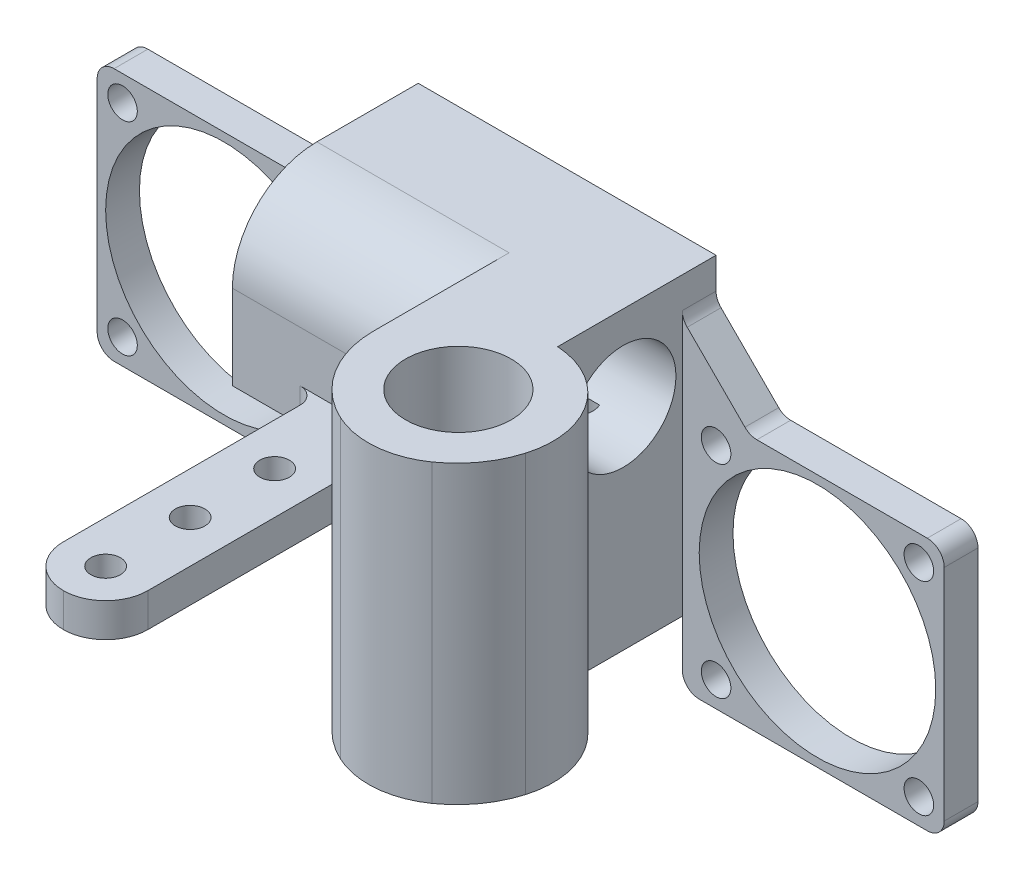
from build123d import *

# Parameters (mm, degrees)
EXTRUDE_1_DEPTH                  = 35
SKETCH_2_W                       = 22
SKETCH_2_H                       = 35
EXTRUDE_2_DEPTH                  = 22.75
SKETCH_3_W                       = 11
SKETCH_3_H                       = 15
CUT_EXTRUDE_1_DEPTH              = 32
HOLE_WIZARD_12_5_12_5_1_D        = 12.5
HOLE_WIZARD_12_5_12_5_2_D        = 12.5
HOLE_WIZARD_3_5_3_5_1_D          = 3.5
HOLE_WIZARD_3_5_3_5_1_DEPTH      = 5
SKETCH_10_W                      = 9.5
SKETCH_10_H                      = 18.75
CUT_EXTRUDE_2_DEPTH              = 64.639610362
SKETCH_11_W                      = 22.75
SKETCH_11_H                      = 11
CUT_EXTRUDE_3_DEPTH              = 15
FILLET_2_R                       = 10
SKETCH_13_W                      = 4
SKETCH_13_H                      = 30
EXTRUDE_3_DEPTH                  = 31
SKETCH_16_W                      = 1.75
SKETCH_16_H                      = 4
HOLE_WIZARD_3_5_3_5_2_AT_2_COUNT = 2
HOLE_WIZARD_3_5_3_5_2_AT_2_PITCH = 24
HOLE_WIZARD_3_5_3_5_2_AT_3_COUNT = 2
HOLE_WIZARD_3_5_3_5_2_AT_3_PITCH = 33.941125497
HOLE_WIZARD_3_5_3_5_2_AT_4_COUNT = 2
HOLE_WIZARD_3_5_3_5_2_AT_4_PITCH = 24
SKETCH_17_R                      = 14
CUT_EXTRUDE_4_DEPTH              = 76.494728698
SKETCH_19_W                      = 4
SKETCH_19_H                      = 30
EXTRUDE_5_DEPTH                  = 34
SKETCH_20_R                      = 14
CUT_EXTRUDE_5_DEPTH              = 76.494728698
SKETCH_22_W                      = 1.75
SKETCH_22_H                      = 4
HOLE_WIZARD_3_5_3_5_3_AT_2_COUNT = 2
HOLE_WIZARD_3_5_3_5_3_AT_2_PITCH = 24
HOLE_WIZARD_3_5_3_5_3_AT_3_COUNT = 2
HOLE_WIZARD_3_5_3_5_3_AT_3_PITCH = 33.941125497
HOLE_WIZARD_3_5_3_5_3_AT_4_COUNT = 2
HOLE_WIZARD_3_5_3_5_3_AT_4_PITCH = 24
EXTRUDE_6_DEPTH                  = 4
EXTRUDE_7_DEPTH                  = 4
SKETCH_26_W                      = 10
SKETCH_26_H                      = 4
EXTRUDE_8_DEPTH                  = 35
HOLE_WIZARD_3_5_3_5_4_D          = 3.5
FILLET_7_R                       = 2
FILLET_9_R                       = 5
FILLET_10_R                      = 10
FILLET_12_R                      = 10
FILLET_13_R                      = 2
FILLET_14_R                      = 2
CUT_EXTRUDE_6_DEPTH              = 86.007352664


# Some blends are built 0.0001 mm under size
with BuildPart() as part:
    # Эскиз1 → Бобышка-Вытянуть1 (new body)
    with BuildSketch(Plane(origin=(0, 35, 0), x_dir=(1, 0, 0), z_dir=(0, 1, 0))):
        with BuildLine():
            Line((35, 0), (13, 0))
            Line((13, 0), (13, -28))
            ThreePointArc((13, -28), (16.514718626, -36.485281374), (25, -40))
            ThreePointArc((25, -40), (32.16515139, -35.913807126), (35, -28.167840434))
            Line((35, -28.167840434), (35, 0))
        make_face()
    extrude(amount=-EXTRUDE_1_DEPTH)

    # Эскиз2 → Бобышка-Вытянуть2 (add)
    with BuildSketch(Plane.ZY.offset(-13)):
        with Locations((11, 17.5)):
            Rectangle(SKETCH_2_W, SKETCH_2_H)
    extrude(amount=EXTRUDE_2_DEPTH)

    # Эскиз3 → Вырез-Вытянуть1 (cut)
    with BuildSketch(Plane.ZY.offset(9.75)):
        with Locations((5.5, 7.5)):
            Rectangle(SKETCH_3_W, SKETCH_3_H)
    extrude(amount=-CUT_EXTRUDE_1_DEPTH, mode=Mode.SUBTRACT)

    # Диаметр отверстия Ø12.5 (12.5)1 (through all)
    with Locations(Plane(origin=(0, 35, 0), x_dir=(1, 0, 0), z_dir=(0, 1, 0))):
        with Locations((24, -29)):
            Hole(HOLE_WIZARD_12_5_12_5_1_D / 2)

    # Диаметр отверстия Ø12.5 (12.5)2 (through all)
    with Locations(Plane(origin=(35, 0, 0), x_dir=(0, 0, -1), z_dir=(1, 0, 0))):
        with Locations((-11, 25)):
            Hole(HOLE_WIZARD_12_5_12_5_2_D / 2)

    # Диаметр отверстия Ø3.5 (3.5)1
    with Locations(Plane(origin=(0, 15, 0), x_dir=(-1, 0, 0), z_dir=(0, -1, 0))):
        with Locations((-17.25, -7), (6.75, -7), (-12.25, -7), (1.75, -7)):
            Hole(HOLE_WIZARD_3_5_3_5_1_D / 2, depth=HOLE_WIZARD_3_5_3_5_1_DEPTH)

    # Эскиз10 → Вырез-Вытянуть2 (cut, through all)
    with BuildSketch(Plane.XZ):
        with Locations((30.25, 9.375)):
            Rectangle(SKETCH_10_W, SKETCH_10_H)
    extrude(amount=-CUT_EXTRUDE_2_DEPTH, mode=Mode.SUBTRACT)

    # Эскиз11 → Вырез-Вытянуть3 (cut)
    with BuildSketch(Plane.XZ):
        with Locations((1.625, 16.5)):
            Rectangle(SKETCH_11_W, SKETCH_11_H)
    extrude(amount=-CUT_EXTRUDE_3_DEPTH, mode=Mode.SUBTRACT)

    # Скругление2
    fillet_2_edges = [part.edges().sort_by_distance(p)[0] for p in [
        (25, 17.5, 40),
    ]]
    fillet(fillet_2_edges, radius=FILLET_2_R)

    # Эскиз19 → Бобышка-Вытянуть5 (add)
    with BuildSketch(Plane.ZY.offset(9.75)):
        with Locations((2, 7.5)):
            Rectangle(SKETCH_19_W, SKETCH_19_H)
    extrude(amount=EXTRUDE_5_DEPTH)

    # Эскиз20 → Вырез-Вытянуть5 (cut, through all)
    with BuildSketch(Plane.XY.offset(4)):
        with Locations((-28.75, 7.5)):
            Circle(SKETCH_20_R)
    extrude(amount=-CUT_EXTRUDE_5_DEPTH, mode=Mode.SUBTRACT)

    # Эскиз22 → Диаметр отверстия Ø3.5 (3.5)3 (revolve, cut)
    with BuildSketch(Plane(origin=(-16.75, 19.5, 4), x_dir=(0, -1, 0), z_dir=(1, 0, 0))):
        with Locations((0.875, 2)):
            Rectangle(SKETCH_22_W, SKETCH_22_H)
    hole_wizard_3_5_3_5_3 = revolve(axis=Axis((-16.75, 19.5, 10.35), (0, 0, -1)), mode=Mode.SUBTRACT)

    # Диаметр отверстия Ø3.5 (3.5)3 at 2: Диаметр отверстия Ø3.5 (3.5)3 ×2
    with Locations(*[(0, -i * HOLE_WIZARD_3_5_3_5_3_AT_2_PITCH, 0) for i in range(1, HOLE_WIZARD_3_5_3_5_3_AT_2_COUNT)]):
        add(hole_wizard_3_5_3_5_3, mode=Mode.SUBTRACT)

    # Диаметр отверстия Ø3.5 (3.5)3 at 3: Диаметр отверстия Ø3.5 (3.5)3 ×2
    with Locations(*[Vector(-0.7071067811865475, -0.7071067811865476, 0) * (i * HOLE_WIZARD_3_5_3_5_3_AT_3_PITCH) for i in range(1, HOLE_WIZARD_3_5_3_5_3_AT_3_COUNT)]):
        add(hole_wizard_3_5_3_5_3, mode=Mode.SUBTRACT)

    # Диаметр отверстия Ø3.5 (3.5)3 at 4: Диаметр отверстия Ø3.5 (3.5)3 ×2
    with Locations(*[(-i * HOLE_WIZARD_3_5_3_5_3_AT_4_PITCH, 0, 0) for i in range(1, HOLE_WIZARD_3_5_3_5_3_AT_4_COUNT)]):
        add(hole_wizard_3_5_3_5_3, mode=Mode.SUBTRACT)

    # Эскиз24 → Бобышка-Вытянуть6 (add)
    with BuildSketch(Plane.XY.offset(4)):
        Polygon((-9.75, 30.5), (-17.75, 22.5), (-9.75, 22.5), align=None)
    extrude(amount=-EXTRUDE_6_DEPTH)



with BuildPart() as body_2:
    # Эскиз13 → Бобышка-Вытянуть3 (new body)
    with BuildSketch(Plane(origin=(25.5, 0, 0), x_dir=(0, 0, -1), z_dir=(1, 0, 0))):
        with Locations((-2, 7.5)):
            Rectangle(SKETCH_13_W, SKETCH_13_H)
    extrude(amount=EXTRUDE_3_DEPTH)

    # Эскиз16 → Диаметр отверстия Ø3.5 (3.5)2 (revolve, cut)
    with BuildSketch(Plane(origin=(29.5, -4.5, 4), x_dir=(0, -1, 0), z_dir=(1, 0, 0))):
        with Locations((0.875, 2)):
            Rectangle(SKETCH_16_W, SKETCH_16_H)
    hole_wizard_3_5_3_5_2 = revolve(axis=Axis((29.5, -4.5, 10.35), (0, 0, -1)), mode=Mode.SUBTRACT)

    # Диаметр отверстия Ø3.5 (3.5)2 at 2: Диаметр отверстия Ø3.5 (3.5)2 ×2
    with Locations(*[(0, i * HOLE_WIZARD_3_5_3_5_2_AT_2_PITCH, 0) for i in range(1, HOLE_WIZARD_3_5_3_5_2_AT_2_COUNT)]):
        add(hole_wizard_3_5_3_5_2, mode=Mode.SUBTRACT)

    # Диаметр отверстия Ø3.5 (3.5)2 at 3: Диаметр отверстия Ø3.5 (3.5)2 ×2
    with Locations(*[Vector(0.7071067811865475, 0.7071067811865476, 0) * (i * HOLE_WIZARD_3_5_3_5_2_AT_3_PITCH) for i in range(1, HOLE_WIZARD_3_5_3_5_2_AT_3_COUNT)]):
        add(hole_wizard_3_5_3_5_2, mode=Mode.SUBTRACT)

    # Диаметр отверстия Ø3.5 (3.5)2 at 4: Диаметр отверстия Ø3.5 (3.5)2 ×2
    with Locations(*[(i * HOLE_WIZARD_3_5_3_5_2_AT_4_PITCH, 0, 0) for i in range(1, HOLE_WIZARD_3_5_3_5_2_AT_4_COUNT)]):
        add(hole_wizard_3_5_3_5_2, mode=Mode.SUBTRACT)

    # Эскиз17 → Вырез-Вытянуть4 (cut, through all)
    with BuildSketch(Plane.XY.offset(4)):
        with Locations((41.5, 7.5)):
            Circle(SKETCH_17_R)
    extrude(amount=-CUT_EXTRUDE_4_DEPTH, mode=Mode.SUBTRACT)


with BuildPart() as part_1:
    add(part.part)

    add(body_2.part)  # Бобышка-Вытянуть7 merges body 2
    # Эскиз25 → Бобышка-Вытянуть7 (add)
    with BuildSketch(Plane.XY.offset(4)):
        Polygon((33.5, 22.5), (25.5, 30.5), (25.5, 22.5), align=None)
    extrude(amount=-EXTRUDE_7_DEPTH)

    # Эскиз26 → Бобышка-Вытянуть8 (add)
    with BuildSketch(Plane.XY.offset(22)):
        with Locations((5.25, 17)):
            Rectangle(SKETCH_26_W, SKETCH_26_H)
    extrude(amount=EXTRUDE_8_DEPTH)

    # Диаметр отверстия Ø3.5 (3.5)4 (through all)
    with Locations(Plane(origin=(0, 15, 0), x_dir=(-1, 0, 0), z_dir=(0, -1, 0))):
        with Locations((-5.25, -52), (-5.25, -42), (-5.25, -32)):
            Hole(HOLE_WIZARD_3_5_3_5_4_D / 2)

    # Скругление7
    fillet_7_edges = [part_1.edges().sort_by_distance(p)[0] for p in [
        (0.25, 17, 22),
        (10.25, 17, 22),
    ]]
    fillet(fillet_7_edges, radius=FILLET_7_R)

    # Скругление9
    fillet_9_edges = [part_1.edges().sort_by_distance(p)[0] for p in [
        (0.25, 17, 57),
        (10.25, 17, 57),
    ]]
    fillet(fillet_9_edges, radius=FILLET_9_R - 0.0001)  # a hair under: the kernel refuses the full size

    # Скругление10
    # the kernel refuses this fillet: 10 mm, written as the material it takes off along each edge
    with BuildSketch(Plane(origin=(35, -32.046488893, 18.75), x_dir=(-0.03816406367220006, 0, 0.999271486756239), z_dir=(0, 1, 0))) as fillet_10_piece_1:
        with BuildLine():
            CenterArc((10.360556073, -9.693195649), FILLET_10_R, 75.770650452, 103.082689776)
            Line((0.362558605, -9.493079124), (-0.637241142, -9.473067472))
            ThreePointArc((-0.637241142, -9.473067472), (-0.817992184, -4.784703626), (-0.999271487, -0.038164064))
            Line((-0.999271487, -0.038164064), (-0.038164064, 0.999271487))
            ThreePointArc((-0.038164064, 0.999271487), (9.372815349, 1.358694549), (13.064399506, 0.969319565))
            Line((13.064399506, 0.969319565), (12.818595557, 0))
        make_face()
    extrude(amount=99.092977786, mode=Mode.SUBTRACT)

    # Скругление12
    fillet_12_edges = [part_1.edges().sort_by_distance(p)[0] for p in [
        (1.625, 35, 22),
    ]]
    fillet(fillet_12_edges, radius=FILLET_12_R)

    # Скругление13
    fillet_13_edges = [part_1.edges().sort_by_distance(p)[0] for p in [
        (-9.75, 30.5, 2),
        (-9.75, -7.5, 2),
        (-43.75, 22.5, 2),
        (-43.75, -7.5, 2),
        (-17.75, 22.5, 2),
    ]]
    fillet(fillet_13_edges, radius=FILLET_13_R)

    # Скругление14
    fillet_14_edges = [part_1.edges().sort_by_distance(p)[0] for p in [
        (56.5, 22.5, 2),
        (25.5, 30.5, 2),
        (33.5, 22.5, 2),
        (25.5, -7.5, 2),
        (56.5, -7.5, 2),
    ]]
    fillet(fillet_14_edges, radius=FILLET_14_R)

    # Эскиз32 → Вырез-Вытянуть6 (cut, through all)
    with BuildSketch(Plane.XY.offset(4)):
        with BuildLine():
            Line((-9.75, 2.270340952), (-9.75, 15))
            ThreePointArc((-9.75, 15), (-10.952290213, 8.635170476), (-9.75, 2.270340952))
        make_face()
    extrude(amount=-CUT_EXTRUDE_6_DEPTH, mode=Mode.SUBTRACT)


solid = part_1.part
